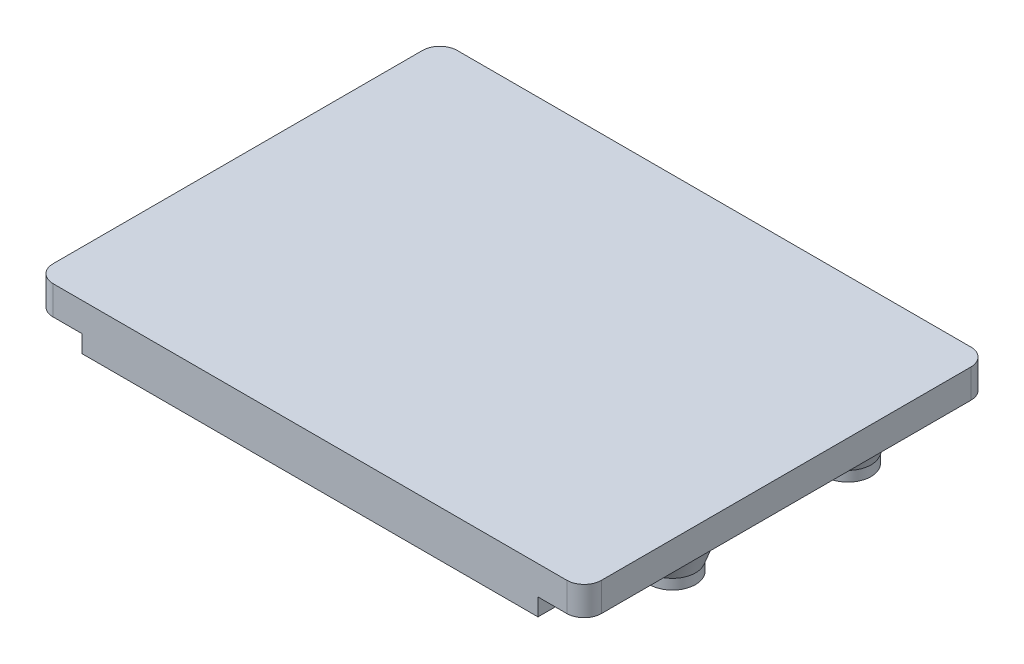
from build123d import *

# Parameters (mm, degrees)
ESQUISSE1_W      = 95
ESQUISSE1_H      = 70
EXTRUSION1_DEPTH = 5
ESQUISSE2_W      = 79
ESQUISSE2_H      = 5
ESQUISSE2_W_2    = 58
ESQUISSE2_W_3    = 5
ESQUISSE2_H_2    = 9
EXTRUSION2_DEPTH = 3
ESQUISSE3_W      = 5
ESQUISSE3_H      = 9
EXTRUSION3_DEPTH = 5
CONG_1_R         = 3
ESQUISSE5_R      = 4
ESQUISSE5_R_2    = 1.6
EXTRUSION4_DEPTH = 10
CHANFREIN1_SIZE  = 3
CHANFREIN1_SIZE2 = 8.242432258


with BuildPart() as part:
    # Esquisse1 → Extrusion1 (new body)
    with BuildSketch(Plane(origin=(0, 0, 0), x_dir=(1, 0, 0), z_dir=(0, 1, 0))):
        Rectangle(ESQUISSE1_W, ESQUISSE1_H)
    extrude(amount=EXTRUSION1_DEPTH)

    # Esquisse2 → Extrusion2 (add)
    with BuildSketch(Plane.XZ):
        with Locations((0, 32.5)):
            Rectangle(ESQUISSE2_W, ESQUISSE2_H)
        with Locations((0.5, -32.5)):
            Rectangle(ESQUISSE2_W_2, ESQUISSE2_H)
        with Locations((-45, -10)):
            Rectangle(ESQUISSE2_W_3, ESQUISSE2_H_2)
    extrude(amount=EXTRUSION2_DEPTH)

    # Esquisse3 → Extrusion3 (add)
    with BuildSketch(Plane.XZ):
        with Locations((-45, 5)):
            Rectangle(ESQUISSE3_W, ESQUISSE3_H)
    extrude(amount=EXTRUSION3_DEPTH)

    # Congé1
    cong_1_edges = [part.edges().sort_by_distance(p)[0] for p in [
        (47.5, 2.5, -35),
        (-47.5, 2.5, -35),
        (-47.5, 2.5, 35),
        (47.5, 2.5, 35),
    ]]
    fillet(cong_1_edges, radius=CONG_1_R)

    # Esquisse5 → Extrusion4 (add)
    # profile 1 of 4: a face of its own
    with BuildSketch(Plane.XZ):
        with Locations((-25.5, 10.5)):
            Circle(ESQUISSE5_R)
        with Locations((-25.5, 10.5)):
            Circle(ESQUISSE5_R_2, mode=Mode.SUBTRACT)
    # profile 2 of 4: a face of its own
    with BuildSketch(Plane.XZ):
        with Locations((37.3, 9.5)):
            Circle(ESQUISSE5_R)
        with Locations((37.3, 9.5)):
            Circle(ESQUISSE5_R_2, mode=Mode.SUBTRACT)
    # profile 3 of 4: a face of its own
    with BuildSketch(Plane.XZ):
        with Locations((36.3, -21.9)):
            Circle(ESQUISSE5_R)
        with Locations((36.3, -21.9)):
            Circle(ESQUISSE5_R_2, mode=Mode.SUBTRACT)
    # profile 4 of 4: a face of its own
    with BuildSketch(Plane.XZ):
        with Locations((-36.5, -23.5)):
            Circle(ESQUISSE5_R)
        with Locations((-36.5, -23.5)):
            Circle(ESQUISSE5_R_2, mode=Mode.SUBTRACT)
    extrude(amount=EXTRUSION4_DEPTH)

    # Chanfrein1
    chanfrein1_edges = [part.edges().sort_by_distance(p)[0] for p in [
        (-29.5, 0, 10.5),
        (-40.5, 0, -23.5),
        (32.3, 0, -21.9),
        (33.3, 0, 9.5),
    ]]
    chanfrein1_side = [part.faces().sort_by_distance(p)[0] for p in [
        (0.586268245, 0, -0.3372194),
    ]]
    chamfer(chanfrein1_edges, length=CHANFREIN1_SIZE, length2=CHANFREIN1_SIZE2, reference=chanfrein1_side[0])


solid = part.part
